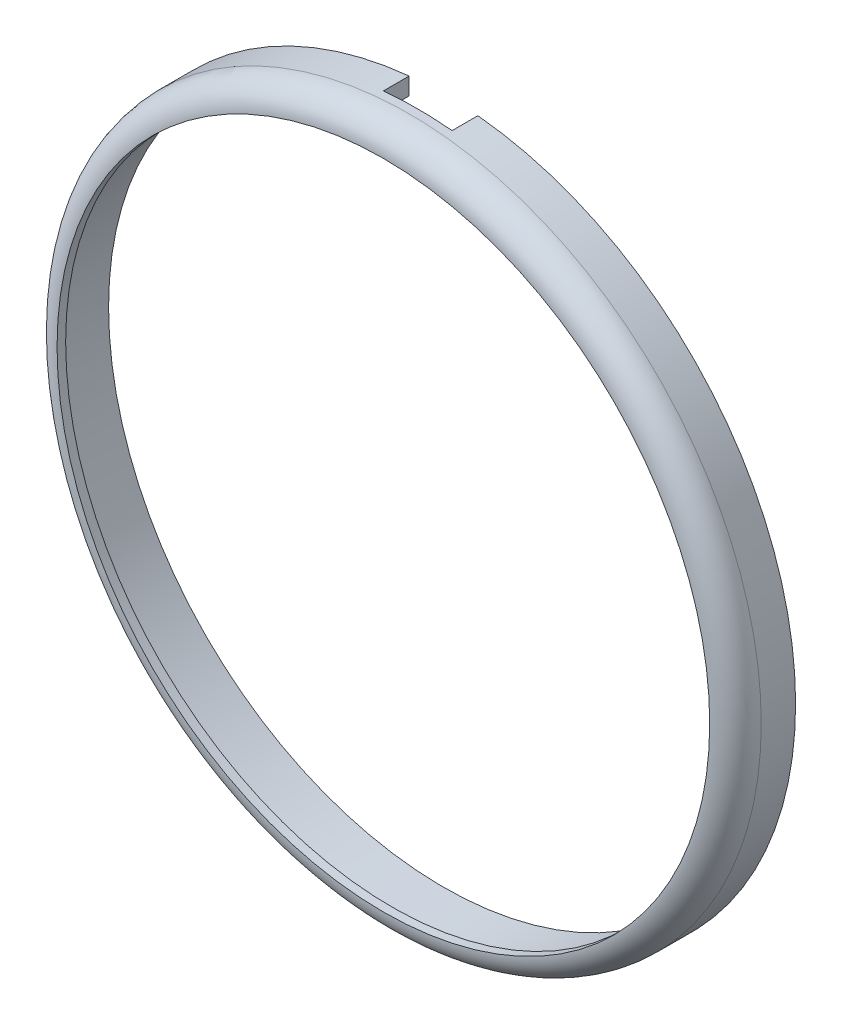
from build123d import *

# Parameters (mm, degrees)
CROQUIS1_R                 = 20.5
SALIENTE_EXTRUIR1_DEPTH    = 3.5
CORTAR_EXTRUIR2_DEPTH      = 3
CORTAR_EXTRUIR2_DEPTH_BACK = 10
CROQUIS3_W                 = 4
CROQUIS3_H                 = 1.5
CROQUIS4_R                 = 19.5
CORTAR_EXTRUIR3_DEPTH      = 3
CROQUIS5_R                 = 19
CORTAR_EXTRUIR4_DEPTH      = 3
REDONDEO1_R                = 1.5


with BuildPart() as part:
    # Croquis1 → Saliente-Extruir1 (new body)
    with BuildSketch(Plane.XY):
        Circle(CROQUIS1_R)
    extrude(amount=SALIENTE_EXTRUIR1_DEPTH)

    # Croquis3 → Cortar-Extruir2 (cut, two sides: drawn at the far end of the back side and taken through both)
    with BuildSketch(Plane(origin=(0, 20, 0), x_dir=(-1, 0, 0), z_dir=(0, 1, 0)).offset(-CORTAR_EXTRUIR2_DEPTH_BACK)):
        with Locations((0, 0.75)):
            Rectangle(CROQUIS3_W, CROQUIS3_H)
    extrude(amount=CORTAR_EXTRUIR2_DEPTH + CORTAR_EXTRUIR2_DEPTH_BACK, mode=Mode.SUBTRACT)

    # Croquis4 → Cortar-Extruir3 (cut)
    with BuildSketch(Plane(origin=(0, 0, 0), x_dir=(-1, 0, 0), z_dir=(0, 0, -1))):
        Circle(CROQUIS4_R)
    extrude(amount=-CORTAR_EXTRUIR3_DEPTH, mode=Mode.SUBTRACT)

    # Croquis5 → Cortar-Extruir4 (cut)
    with BuildSketch(Plane(origin=(0, 0, 3), x_dir=(-1, 0, 0), z_dir=(0, 0, -1))):
        Circle(CROQUIS5_R)
    extrude(amount=-CORTAR_EXTRUIR4_DEPTH, mode=Mode.SUBTRACT)

    # Redondeo1
    redondeo1_edges = [part.edges().sort_by_distance(p)[0] for p in [
        (-20.5, 0, 3.5),
    ]]
    fillet(redondeo1_edges, radius=REDONDEO1_R - 0.0001)  # a hair under: the kernel refuses the full size


solid = part.part
